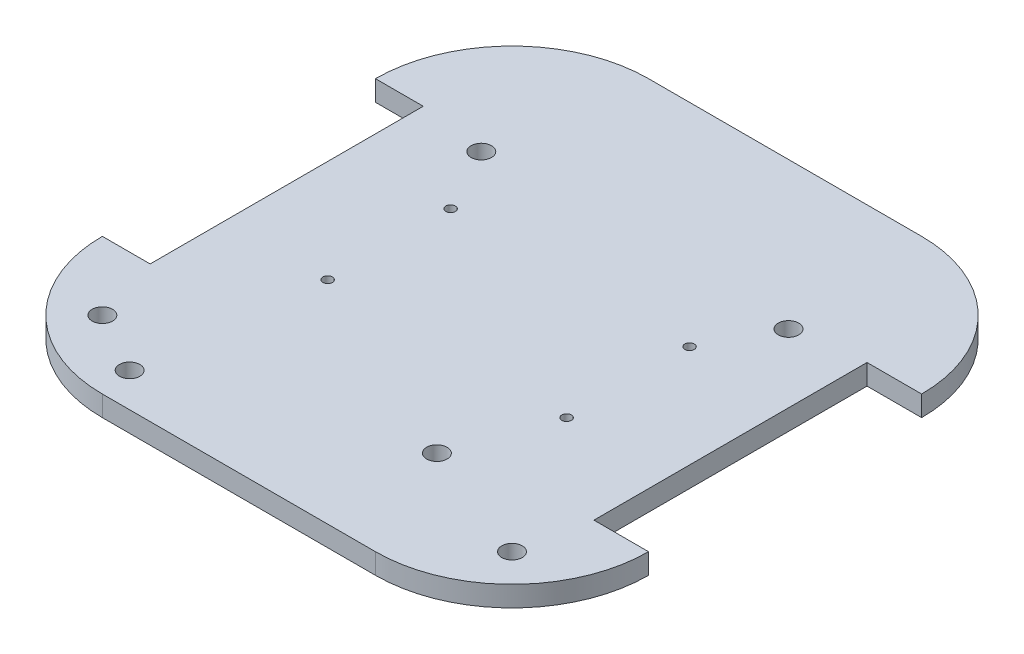
from build123d import *

# Parameters (mm, degrees)
SKETCH3_W           = 80
SKETCH3_H           = 80
BOSS_EXTRUDE1_DEPTH = 3
SKETCH4_W           = 7
SKETCH4_H           = 40
SKETCH4_W_2         = 8
CUT_EXTRUDE1_DEPTH  = 3
FILLET3_R           = 20
FILLET4_R           = 20
FILLET5_R           = 20
FILLET6_R           = 20
SKETCH6_R           = 1.5
CUT_EXTRUDE2_DEPTH  = 3
SKETCH9_R           = 1.5
CUT_EXTRUDE3_DEPTH  = 3
SKETCH10_R          = 1.5
CUT_EXTRUDE4_DEPTH  = 3
SKETCH11_R          = 0.7
CUT_EXTRUDE5_DEPTH  = 3


with BuildPart() as part:
    # Sketch3 → Boss-Extrude1 (new body)
    with BuildSketch(Plane(origin=(0, 0, 0), x_dir=(1, 0, 0), z_dir=(0, 1, 0))):
        with Locations((40, 40)):
            Rectangle(SKETCH3_W, SKETCH3_H)
    extrude(amount=BOSS_EXTRUDE1_DEPTH)

    # Sketch4 → Cut-Extrude1 (cut)
    with BuildSketch(Plane(origin=(0, 3, 0), x_dir=(1, 0, 0), z_dir=(0, 1, 0))):
        with Locations((3.5, 40)):
            Rectangle(SKETCH4_W, SKETCH4_H)
        with Locations((76, 40)):
            Rectangle(SKETCH4_W_2, SKETCH4_H)
    extrude(amount=-CUT_EXTRUDE1_DEPTH, mode=Mode.SUBTRACT)

    # Fillet3
    fillet3_edges = [part.edges().sort_by_distance(p)[0] for p in [
        (0, 1.5, -80),
    ]]
    fillet(fillet3_edges, radius=FILLET3_R - 0.0001)  # a hair under: the kernel refuses the full size

    # Fillet4
    fillet4_edges = [part.edges().sort_by_distance(p)[0] for p in [
        (80, 1.5, -80),
    ]]
    fillet(fillet4_edges, radius=FILLET4_R - 0.0001)  # a hair under: the kernel refuses the full size

    # Fillet5
    fillet5_edges = [part.edges().sort_by_distance(p)[0] for p in [
        (80, 1.5, 0),
    ]]
    fillet(fillet5_edges, radius=FILLET5_R - 0.0001)  # a hair under: the kernel refuses the full size

    # Fillet6
    fillet6_edges = [part.edges().sort_by_distance(p)[0] for p in [
        (0, 1.5, 0),
    ]]
    fillet(fillet6_edges, radius=FILLET6_R - 0.0001)  # a hair under: the kernel refuses the full size

    # Sketch6 → Cut-Extrude2 (cut)
    with BuildSketch(Plane(origin=(0, 3, 0), x_dir=(1, 0, 0), z_dir=(0, 1, 0))):
        with Locations(Location((17, 58.5, 0), (0, 0, 270))):
            Circle(SKETCH6_R)
        with Locations(Location((62, 58.5, 0), (0, 0, 270))):
            Circle(SKETCH6_R)
    extrude(amount=-CUT_EXTRUDE2_DEPTH, mode=Mode.SUBTRACT)

    # Sketch9 → Cut-Extrude3 (cut)
    with BuildSketch(Plane(origin=(0, 3, 0), x_dir=(1, 0, 0), z_dir=(0, 1, 0))):
        with Locations(Location((70, 10, 0), (0, 0, 270))):
            Circle(SKETCH9_R)
        with Locations(Location((10, 10, 0), (0, 0, 270))):
            Circle(SKETCH9_R)
    extrude(amount=-CUT_EXTRUDE3_DEPTH, mode=Mode.SUBTRACT)

    # Sketch10 → Cut-Extrude4 (cut)
    with BuildSketch(Plane(origin=(0, 3, 0), x_dir=(1, 0, 0), z_dir=(0, 1, 0))):
        with Locations(Location((19, 5, 0), (0, 0, 270))):
            Circle(SKETCH10_R)
        with Locations(Location((52, 17, 0), (0, 0, 270))):
            Circle(SKETCH10_R)
    extrude(amount=-CUT_EXTRUDE4_DEPTH, mode=Mode.SUBTRACT)

    # Sketch11 → Cut-Extrude5 (cut)
    with BuildSketch(Plane(origin=(0, 3, 0), x_dir=(1, 0, 0), z_dir=(0, 1, 0))):
        with Locations(Location((22, 49, 0), (0, 0, 270))):
            Circle(SKETCH11_R)
        with Locations(Location((22, 31, 0), (0, 0, 270))):
            Circle(SKETCH11_R)
        with Locations(Location((57, 49, 0), (0, 0, 270))):
            Circle(SKETCH11_R)
        with Locations(Location((57, 31, 0), (0, 0, 270))):
            Circle(SKETCH11_R)
    extrude(amount=-CUT_EXTRUDE5_DEPTH, mode=Mode.SUBTRACT)


solid = part.part
